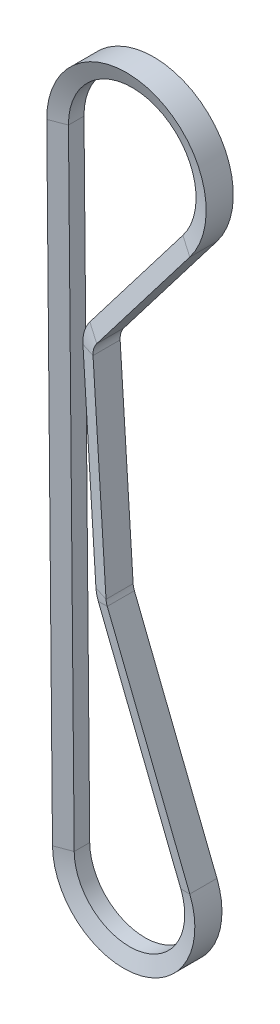
from build123d import *


with BuildPart() as part:
    # Sweep1: sweep along a path in Sketch2
    with BuildLine(Plane.XY) as sweep1_path:
        Line((23.214951037, 202.975824821), (-9.470857893, 160.286082423))
        ThreePointArc((-9.470857893, 160.286082423), (-10.504711126, 158.271903355), (-10.766224787, 156.023041325))
        Line((-10.766224787, 156.023041325), (-6.200182217, 84.167970138))
        ThreePointArc((-6.200182217, 84.167970138), (-6.05880434, 83.179963381), (-5.764361657, 82.226313254))
        Line((-5.764361657, 82.226313254), (23.233848519, 9.229749888))
        ThreePointArc((23.233848519, 9.229749888), (4.811111482, -24.532696678), (-24.998949393, -0.229192636))
        Line((-24.998949393, -0.229192636), (-27.015657058, 219.741107383))
        ThreePointArc((-27.015657058, 219.741107383), (9.847891765, 246.557483889), (23.214951037, 202.975824821))
    # Sketch3 → Sweep1 (sweep)
    with BuildSketch(Plane(origin=(23.233848519, 9.229749888, 0), x_dir=(0, 0, -1), z_dir=(0.36918999552490434, -0.9293539407590206, 0))):
        Polygon((-4.7625, 0), (4.7625, 0), (2.728634331, -5.588), (-2.728634331, -5.588), align=None)
    sweep(path=sweep1_path.line)


solid = part.part
